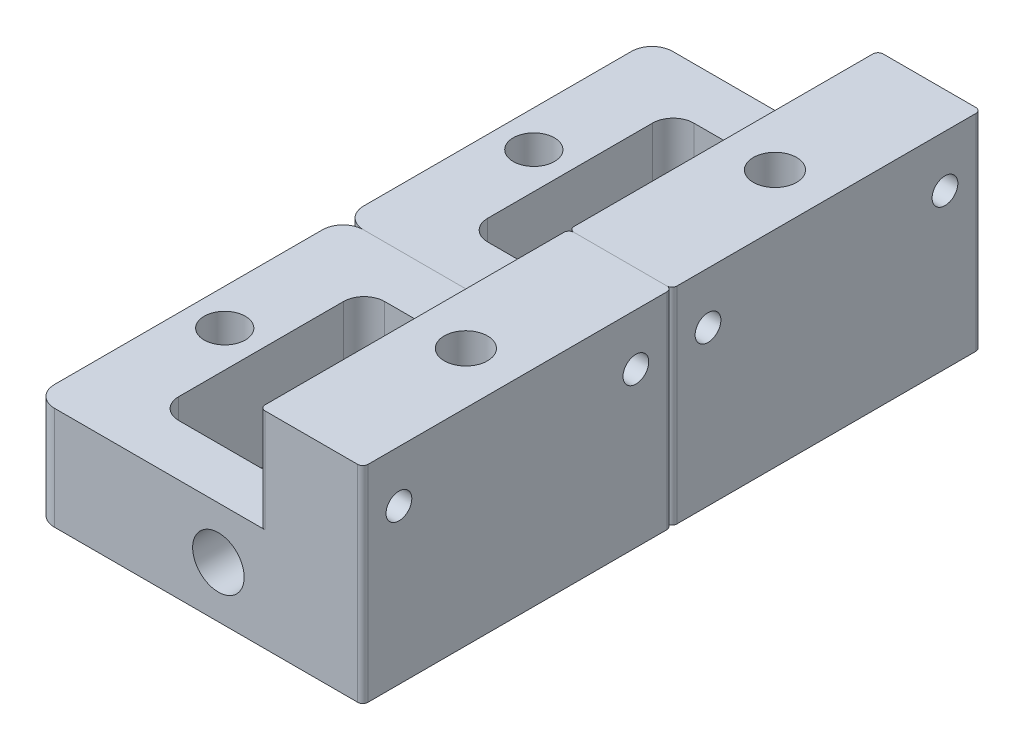
from build123d import *

# Parameters (mm, degrees)
SKETCH1_W                   = 31.93
SKETCH1_H                   = 30
SKETCH1_W_2                 = 14.88
SKETCH1_H_2                 = 20
BOSS_EXTRUDE1_DEPTH         = 10
SKETCH2_W                   = 10
SKETCH2_H                   = 30
BOSS_EXTRUDE2_DEPTH         = 10
TAP_DRILL_FOR_M5X0_8_TAP1_D = 4.2
FILLET2_R                   = 2
SKETCH5_R                   = 2.5
CUT_EXTRUDE2_DEPTH          = 37.457558887
TAP_DRILL_FOR_M4X0_7_TAP1_D = 3.3
FILLET3_R                   = 2
FILLET4_R                   = 0.5
TAP_DRILL_FOR_M3X0_5_TAP1_D = 2.5
F_4_0_4_DIAMETER_HOLE1_D    = 4


with BuildPart() as part:
    # Sketch1 → Boss-Extrude1 (new body)
    with BuildSketch(Plane(origin=(0, 0, 0), x_dir=(1, 0, 0), z_dir=(0, 1, 0))):
        with Locations((1.475, 0)):
            Rectangle(SKETCH1_W, SKETCH1_H)
        Rectangle(SKETCH1_W_2, SKETCH1_H_2, mode=Mode.SUBTRACT)
    extrude(amount=BOSS_EXTRUDE1_DEPTH)

    # Sketch2 → Boss-Extrude2 (add)
    with BuildSketch(Plane(origin=(0, 10, 0), x_dir=(1, 0, 0), z_dir=(0, 1, 0))):
        with Locations((12.44, 0)):
            Rectangle(SKETCH2_W, SKETCH2_H)
    extrude(amount=BOSS_EXTRUDE2_DEPTH)

    # Tap Drill for M5x0.8 Tap1 (through all)
    with Locations(Plane(origin=(0, 20, 0), x_dir=(1, 0, 0), z_dir=(0, 1, 0))):
        with Locations((12.44, 0)):
            Hole(TAP_DRILL_FOR_M5X0_8_TAP1_D / 2)

    # Fillet2
    fillet2_edges = [part.edges().sort_by_distance(p)[0] for p in [
        (-7.44, 5, 10),
        (-7.44, 5, -10),
        (7.44, 5, -10),
        (7.44, 5, 10),
    ]]
    fillet(fillet2_edges, radius=FILLET2_R)

    # Sketch5 → Cut-Extrude2 (cut, through all)
    with BuildSketch(Plane.XY.offset(-10)):
        with Locations((3.42, 5)):
            Circle(SKETCH5_R)
    extrude(amount=CUT_EXTRUDE2_DEPTH, mode=Mode.SUBTRACT)

    # Tap Drill for M4x0.7 Tap1 (through all)
    with Locations(Plane.XY.offset(-10)):
        with Locations((3.42, 5)):
            Hole(TAP_DRILL_FOR_M4X0_7_TAP1_D / 2)

    # Fillet3
    fillet3_edges = [part.edges().sort_by_distance(p)[0] for p in [
        (-14.49, 5, -15),
        (-14.49, 5, 15),
    ]]
    fillet(fillet3_edges, radius=FILLET3_R)

    # Fillet4
    fillet4_edges = [part.edges().sort_by_distance(p)[0] for p in [
        (17.44, 10, 15),
        (17.44, 10, -15),
        (7.44, 15, -15),
        (7.44, 15, 15),
    ]]
    fillet(fillet4_edges, radius=FILLET4_R)

    # Tap Drill for M3x0.5 Tap1 (through all)
    with Locations(Plane.ZY.offset(-7.44)):
        with Locations((-11.5, 15), (11.5, 15)):
            Hole(TAP_DRILL_FOR_M3X0_5_TAP1_D / 2)

    # Ø4.0 (4) Diameter Hole1 (through all)
    with Locations(Plane(origin=(0, 10, 0), x_dir=(1, 0, 0), z_dir=(0, 1, 0))):
        with Locations((-10.965, 0)):
            Hole(F_4_0_4_DIAMETER_HOLE1_D / 2)


with BuildPart() as body_2:
    # Mirror1: mirrored copy
    add(part.part.mirror(Plane(origin=(17.44, 10, -15), x_dir=(1, 0, 0), z_dir=(0, 0, 1))))


solid = Compound([part.part, body_2.part])
